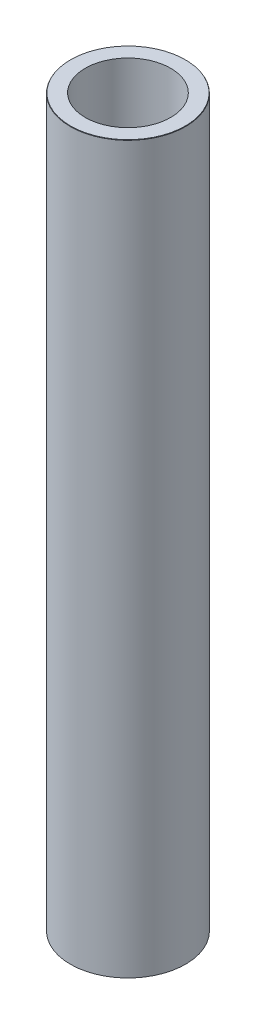
from build123d import *
from OCP.BRepFilletAPI import BRepFilletAPI_MakeChamfer

# Parameters (mm, degrees)
SKETCH1_R           = 32.5
BOSS_EXTRUDE1_DEPTH = 409.530352016
SKETCH2_R           = 24.085501396
CUT_EXTRUDE1_DEPTH  = 413.101455011
CHAMFER1_SIZE       = 0.22865988
CHAMFER1_SIZE2      = 0.132016843


with BuildPart() as part:
    # Sketch1 → Boss-Extrude1 (new body)
    with BuildSketch(Plane(origin=(0, 0, 0), x_dir=(1, 0, 0), z_dir=(0, 1, 0))):
        Circle(SKETCH1_R)
    extrude(amount=BOSS_EXTRUDE1_DEPTH)

    # Sketch2 → Cut-Extrude1 (cut, through all)
    with BuildSketch(Plane(origin=(0, 0, 0), x_dir=(1, 0, 0), z_dir=(0, 1, 0))):
        Circle(SKETCH2_R)
    extrude(amount=CUT_EXTRUDE1_DEPTH, mode=Mode.SUBTRACT)

    # Chamfer1: one chamfer whose edges measure the first distance from different faces: ONE call of the kernel's chamfer builder (chamfer() names one face for all edges)
    chamfer1_edges_1 = [part.edges().sort_by_distance(p)[0] for p in [
        (-32.5, 409.530352016, 0),
    ]]
    chamfer1_side_1 = [part.faces().sort_by_distance(p)[0] for p in [
        (-32.5, 204.765176008, 0),
    ]]
    chamfer1_edges_2 = [part.edges().sort_by_distance(p)[0] for p in [
        (-32.5, 0, 0),
    ]]
    chamfer1_side_2 = [part.faces().sort_by_distance(p)[0] for p in [
        (-31.580761184, 0, 0),
    ]]
    chamfer1 = BRepFilletAPI_MakeChamfer(part.part.solid().wrapped)
    for e in chamfer1_edges_1:
        chamfer1.Add(CHAMFER1_SIZE, CHAMFER1_SIZE2, e.wrapped, chamfer1_side_1[0].wrapped)  # the first distance lies on this face
    for e in chamfer1_edges_2:
        chamfer1.Add(CHAMFER1_SIZE, CHAMFER1_SIZE2, e.wrapped, chamfer1_side_2[0].wrapped)  # the first distance lies on this face
    add(Compound.cast(chamfer1.Shape()), mode=Mode.REPLACE)


solid = part.part
